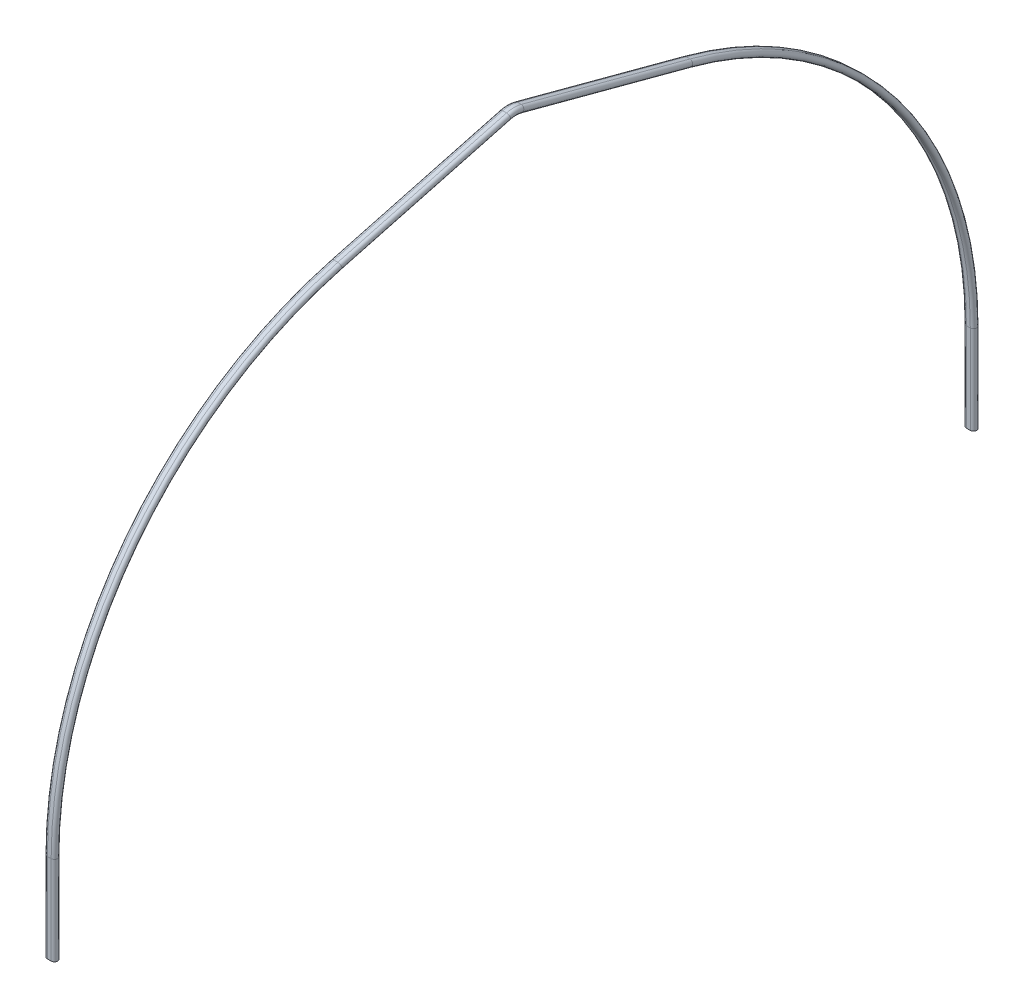
from build123d import *


with BuildPart() as part:
    # Sweep1: sweep along a path in Sketch4
    with BuildLine(Plane(origin=(0, 0, 0), x_dir=(0, 0, -1), z_dir=(1, 0, 0))) as sweep1_path:
        Line((0, 0), (0, 882.85962715))
        ThreePointArc((0, 882.85962715), (788.712459745, 3204.049321919), (2828.305301365, 4564.214747031))
        Line((2828.305301365, 4564.214747031), (4506.553686758, 5011.747649802))
        ThreePointArc((4506.553686758, 5011.747649802), (4572, 5020.323975143), (4637.446313242, 5011.747649802))
        Line((4637.446313242, 5011.747649802), (6315.694698635, 4564.214747031))
        ThreePointArc((6315.694698635, 4564.214747031), (8355.287540255, 3204.049321919), (9144, 882.85962715))
        Line((9144, 882.85962715), (9144, 0))
    # Sketch1 → Sweep1 (sweep)
    with BuildSketch(Plane(origin=(0, 0, 0), x_dir=(1, 0, 0), z_dir=(0, 1, 0))):
        with BuildLine():
            Line((0, 31.75), (38.1, 31.75))
            ThreePointArc((38.1, 31.75), (69.85, 0), (38.1, -31.75))
            Line((38.1, -31.75), (0, -31.75))
            ThreePointArc((0, -31.75), (-31.75, 0), (0, 31.75))
        make_face()
        with BuildLine():
            Line((0, 20.304779167), (38.1, 20.304779167))
            ThreePointArc((38.1, 20.304779167), (58.404779167, 0), (38.1, -20.304779167))
            Line((38.1, -20.304779167), (0, -20.304779167))
            ThreePointArc((0, -20.304779167), (-20.304779167, 0), (0, 20.304779167))
        make_face(mode=Mode.SUBTRACT)
    sweep(path=sweep1_path.line)


solid = part.part
